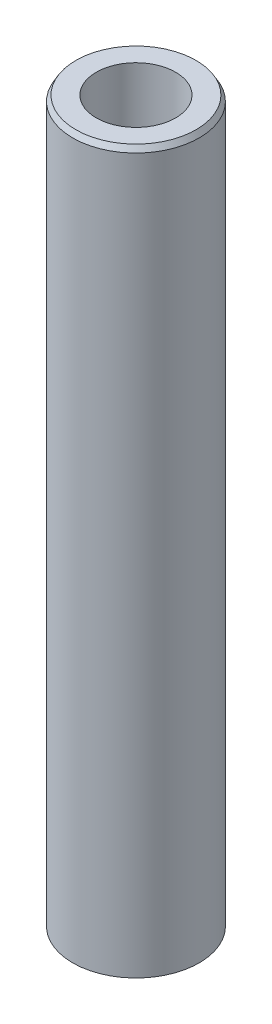
from build123d import *
from OCP.BRepFilletAPI import BRepFilletAPI_MakeChamfer

# Parameters (mm, degrees)
SKETCH1_R           = 52.5
BOSS_EXTRUDE1_DEPTH = 600
SKETCH2_R           = 32.906681028
CUT_EXTRUDE1_DEPTH  = 605.576297914
CHAMFER1_SIZE       = 4.563861876
CHAMFER1_SIZE2      = 2.634946883


with BuildPart() as part:
    # Sketch1 → Boss-Extrude1 (new body)
    with BuildSketch(Plane(origin=(0, 0, 0), x_dir=(1, 0, 0), z_dir=(0, 1, 0))):
        Circle(SKETCH1_R)
    extrude(amount=BOSS_EXTRUDE1_DEPTH)

    # Sketch2 → Cut-Extrude1 (cut, through all)
    with BuildSketch(Plane(origin=(0, 0, 0), x_dir=(1, 0, 0), z_dir=(0, 1, 0))):
        Circle(SKETCH2_R)
    extrude(amount=CUT_EXTRUDE1_DEPTH, mode=Mode.SUBTRACT)

    # Chamfer1: one chamfer whose edges measure the first distance from different faces: ONE call of the kernel's chamfer builder (chamfer() names one face for all edges)
    chamfer1_edges_1 = [part.edges().sort_by_distance(p)[0] for p in [
        (-52.5, 600, 0),
    ]]
    chamfer1_side_1 = [part.faces().sort_by_distance(p)[0] for p in [
        (-52.5, 300, 0),
    ]]
    chamfer1_edges_2 = [part.edges().sort_by_distance(p)[0] for p in [
        (-52.5, 0, 0),
    ]]
    chamfer1_side_2 = [part.faces().sort_by_distance(p)[0] for p in [
        (-51.01507576, 0, 0),
    ]]
    chamfer1 = BRepFilletAPI_MakeChamfer(part.part.solid().wrapped)
    for e in chamfer1_edges_1:
        chamfer1.Add(CHAMFER1_SIZE, CHAMFER1_SIZE2, e.wrapped, chamfer1_side_1[0].wrapped)  # the first distance lies on this face
    for e in chamfer1_edges_2:
        chamfer1.Add(CHAMFER1_SIZE, CHAMFER1_SIZE2, e.wrapped, chamfer1_side_2[0].wrapped)  # the first distance lies on this face
    add(Compound.cast(chamfer1.Shape()), mode=Mode.REPLACE)


solid = part.part
